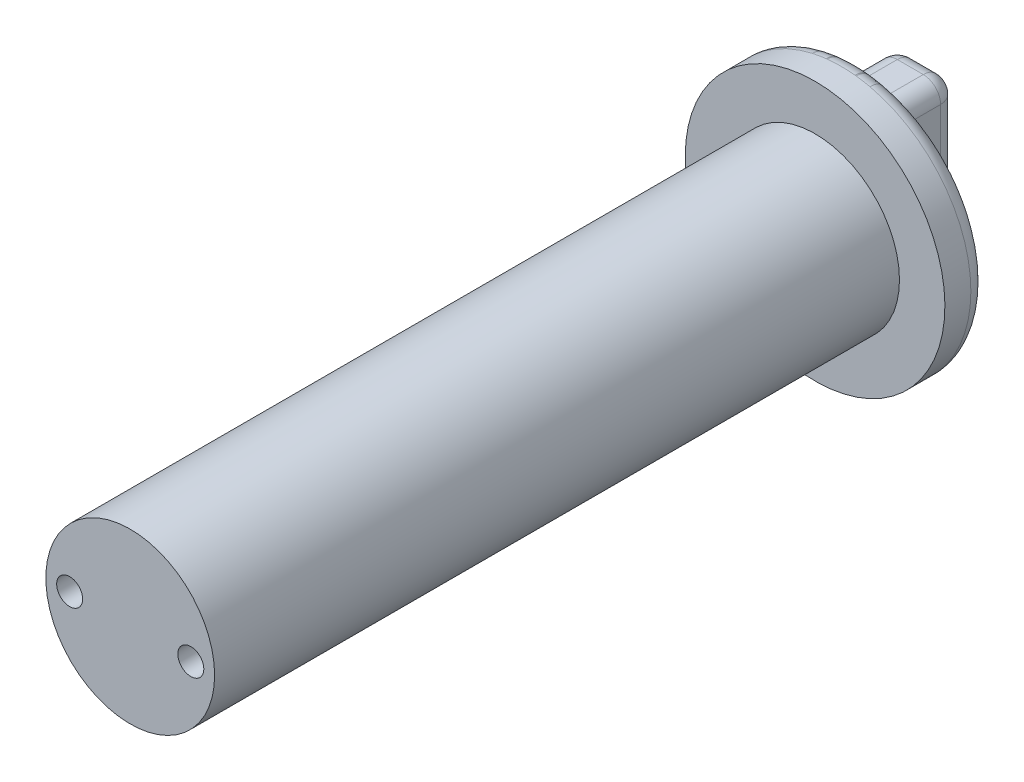
from build123d import *

# Parameters (mm, degrees)
SKETCH1_R           = 9.75
BOSS_EXTRUDE1_DEPTH = 79.125
SKETCH2_R           = 15
BOSS_EXTRUDE2_DEPTH = 5
SKETCH3_W           = 7
SKETCH3_H           = 21.84901374
BOSS_EXTRUDE4_DEPTH = 8
FILLET1_R           = 2
FILLET2_R           = 2
SKETCH4_R           = 1.5
M4_DRILL_DEPTH      = 8


with BuildPart() as part:
    # Sketch1 → Boss-Extrude1 (new body)
    with BuildSketch(Plane.XY):
        Circle(SKETCH1_R)
    extrude(amount=BOSS_EXTRUDE1_DEPTH)

    # Sketch2 → Boss-Extrude2 (add)
    with BuildSketch(Plane(origin=(0, 0, 0), x_dir=(-1, 0, 0), z_dir=(0, 0, -1))):
        Circle(SKETCH2_R)
    extrude(amount=BOSS_EXTRUDE2_DEPTH)

    # Sketch3 → Boss-Extrude4 (add)
    with BuildSketch(Plane(origin=(0, 0, -5), x_dir=(-1, 0, 0), z_dir=(0, 0, -1))):
        Rectangle(SKETCH3_W, SKETCH3_H)
    extrude(amount=BOSS_EXTRUDE4_DEPTH)

    # Fillet1
    fillet1_edges = [part.edges().sort_by_distance(p)[0] for p in [
        (-3.5, 0, -5),
        (-3.5, -10.92450687, -9),
        (0, 10.92450687, -5),
        (-3.5, 10.92450687, -9),
        (3.5, 0, -5),
        (3.5, 10.92450687, -9),
        (0, -10.92450687, -5),
        (3.5, -10.92450687, -9),
        (-3.5, 0, -13),
        (0, 10.92450687, -13),
        (3.5, 0, -13),
        (0, -10.92450687, -13),
    ]]
    fillet(fillet1_edges, radius=FILLET1_R)

    # Fillet2
    # the kernel refuses this fillet: 2 mm, written as the material it takes off along each edge
    with BuildSketch(Plane(origin=(0, 0, -5), x_dir=(-1, 0, 0), z_dir=(0, -1, 0))) as fillet2_piece_1:
        with BuildLine():
            CenterArc((15 - FILLET2_R, -FILLET2_R), FILLET2_R, 0, 90)
            Line((15, -FILLET2_R), (15 + FILLET2_R * 0.02, -FILLET2_R))
            Line((15 + FILLET2_R * 0.02, -FILLET2_R), (15 + FILLET2_R * 0.02, FILLET2_R * 0.02))
            Line((15 + FILLET2_R * 0.02, FILLET2_R * 0.02), (15 - FILLET2_R, FILLET2_R * 0.02))
            Line((15 - FILLET2_R, FILLET2_R * 0.02), (15 - FILLET2_R, 0))
        make_face()
    revolve(axis=Axis((0, 0, -5), (0, 0, -1)), mode=Mode.SUBTRACT)

    # Sketch4 → M4_DRILL (cut)
    with BuildSketch(Plane.XY.offset(79.125)):
        with Locations((-7, 0)):
            Circle(SKETCH4_R)
        with Locations(Location((7, 0, 0), (0, 0, 180))):
            Circle(SKETCH4_R)
    extrude(amount=-M4_DRILL_DEPTH, mode=Mode.SUBTRACT)


solid = part.part
